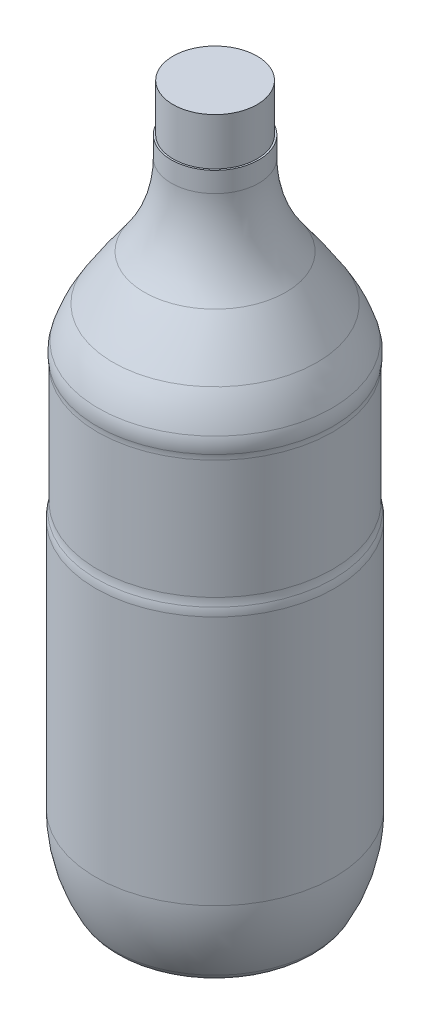
from build123d import *

# Parameters (mm, degrees)
FILLET1_R = 10
FILLET2_R = 10
FILLET3_R = 10
FILLET4_R = 10


with BuildPart() as part:
    # Sketch11 → Revolve3 (revolve)
    with BuildSketch(Plane.XY, mode=Mode.PRIVATE) as revolve3_sk:
        with BuildLine():
            Line((-40.205353817, 81.434518384), (-52.705353817, 81.434518384))
            Line((-52.705353817, 81.434518384), (-52.705353817, 67.434518384))
            Line((-52.705353817, 67.434518384), (-53.205353817, 67.434518384))
            Line((-53.205353817, 67.434518384), (-53.205353817, 61.434518384))
            ThreePointArc((-53.205353817, 61.434518384), (-55.271152405, 48.746084155), (-61.255171978, 37.3682374))
            ThreePointArc((-61.255171978, 37.3682374), (-66.034459856, 30.746173564), (-70.539421099, 23.934518384))
            ThreePointArc((-70.539421099, 23.934518384), (-73.644556235, 17.965754776), (-75.705353817, 11.560981826))
            Line((-75.705353817, 11.560981826), (-75.155353817, 11.560981826))
            Line((-75.155353817, 11.560981826), (-75.155353817, -28.439018174))
            Line((-75.155353817, -28.439018174), (-75.705353817, -28.439018174))
            Line((-75.705353817, -28.439018174), (-75.705353817, -106.065481616))
            ThreePointArc((-75.705353817, -106.065481616), (-74.256681446, -117.391639913), (-70.003937739, -127.988558539))
            ThreePointArc((-70.003937739, -127.988558539), (-65.767030137, -130.98106987), (-60.780549326, -129.552252449))
            ThreePointArc((-60.780549326, -129.552252449), (-51.166904083, -124.242642631), (-40.205353817, -123.565481616))
            Line((-40.205353817, -123.565481616), (-40.205353817, -122.895686873))
            Line((-40.205353817, -122.895686873), (-40.205353817, 81.434518384))
        make_face()
    revolve(revolve3_sk.sketch.rotate(Axis((-40.205353817, -122.895686873, 0), (0, 1, 0)), 180), axis=Axis((-40.205353817, -122.895686873, 0), (0, 1, 0)))

    # Fillet1
    # the kernel refuses this fillet: 10 mm, written as the material it takes off along each edge
    with BuildSketch(Plane(origin=(-40.205353817, -28.439018174, 0), x_dir=(1, 0, 0), z_dir=(0, 0, 1))) as fillet1_piece_1:
        with BuildLine():
            CenterArc((25.5, -3.270703288), FILLET1_R, 360, 19.091052513)
            Line((35.5, -3.270703288), (35.7, -3.270703288))
            Line((35.7, -3.270703288), (35.7, 0))
            Line((35.7, 0), (35.5, 0.2))
            ThreePointArc((35.5, 0.2), (35.225, 0.2), (35.139, 0.065414066))
            Line((35.139, 0.065414066), (34.95, 0))
        make_face()
    revolve(axis=Axis((-40.205353817, -28.439018174, 0), (0, 1, 0)), mode=Mode.SUBTRACT)

    # Fillet2
    fillet2_edges = [part.edges().sort_by_distance(p)[0] for p in [
        (-75.155353817, -28.439018174, 0),
    ]]
    fillet(fillet2_edges, radius=FILLET2_R)

    # Fillet3
    # the kernel refuses this fillet: 10 mm, written as the material it adds along each edge
    with BuildSketch(Plane(origin=(-40.205353817, 11.560981826, 0), x_dir=(1, 0, 0), z_dir=(0, 0, 1))) as fillet3_piece_1:
        with BuildLine():
            CenterArc((44.95, -3.270703288), FILLET3_R, 160.908947487, 19.091052513)
            Line((35.5, 0), (35.311, 0.065414066))
            ThreePointArc((35.311, 0.065414066), (35.225, 0.2), (34.95, 0.2))
            Line((34.95, 0.2), (34.75, 0))
            Line((34.75, 0), (34.75, -3.270703288))
            Line((34.75, -3.270703288), (34.95, -3.270703288))
        make_face()
    revolve(axis=Axis((-40.205353817, 11.560981826, 0), (0, 1, 0)))

    # Fillet4
    fillet4_edges = [part.edges().sort_by_distance(p)[0] for p in [
        (-75.705353817, 11.560981826, 0),
    ]]
    fillet(fillet4_edges, radius=FILLET4_R)


solid = part.part
